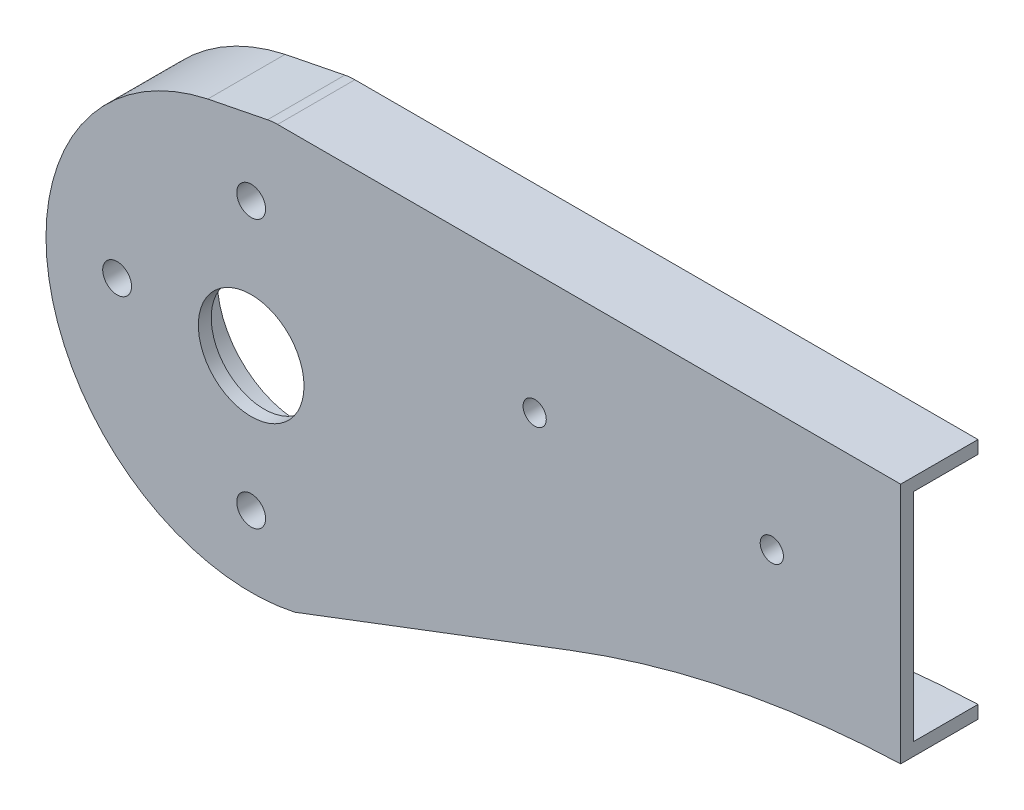
from build123d import *

# Parameters (mm, degrees)
ESTRUSIONE_ESTRUSIONE1_DEPTH = 2.5
ESTRUSIONE_ESTRUSIONE2_DEPTH = 15
SCHIZZO2_R                   = 10.25
SCHIZZO2_R_2                 = 2.8
TAGLIO_ESTRUSIONE1_DEPTH     = 15
SCHIZZO3_R                   = 16.1
SCHIZZO3_R_2                 = 14.5
ESTRUSIONE_ESTRUSIONE3_DEPTH = 0.5
SCHIZZO3_3_R                 = 6.3
SCHIZZO3_3_R_2               = 2.25
ESTRUSIONE_ESTRUSIONE4_DEPTH = 3
SCHIZZO3_4_R                 = 5
SCHIZZO3_4_R_2               = 2.8
ESTRUSIONE_ESTRUSIONE5_DEPTH = 5.6
SCHIZZO3_5_R                 = 18.6
SCHIZZO3_5_R_2               = 16.1
ESTRUSIONE_ESTRUSIONE6_DEPTH = 7
SMUSSO1_SIZE                 = 1.5
FORO_PER_VITE_M4_1_D         = 4.5
FORO_PER_VITE_M4_1_DEPTH     = 50
FORO_PER_VITE_M4_1_TIP       = 1.351936393


with BuildPart() as part:
    # Schizzo1 → Estrusione-Estrusione1 (new body)
    with BuildSketch(Plane.XY):
        with BuildLine():
            Line((126, -3.098457484), (126, 38.9))
            Line((126, 38.9), (5.368261151, 38.9))
            ThreePointArc((5.368261151, 38.9), (4.386962529, 38.851736181), (3.415136151, 38.707410603))
            Line((3.415136151, 38.707410603), (-7.887409345, 36.456532663))
            ThreePointArc((-7.887409345, 36.456532663), (-36.456532663, -7.887409345), (7.887409345, -36.456532663))
            Line((7.887409345, -36.456532663), (61.100428827, -16.194450472))
            ThreePointArc((61.100428827, -16.194450472), (93.011370492, -6.976115085), (126, -3.098457484))
        make_face()
        with BuildLine():
            Line((126, 41.4), (5.123487201, 41.4))
            ThreePointArc((5.123487201, 41.4), (4.142188579, 41.351736181), (3.170362201, 41.207410603))
            Line((3.170362201, 41.207410603), (-7.128704932, 39.156373249))
            Line((-7.128704932, 39.156373249), (-8.416056083, 38.9))
            ThreePointArc((-8.416056083, 38.9), (-38.9, -8.416056083), (8.416056083, -38.9))
            Line((8.416056083, -38.9), (61.98889523, -18.531249019))
            ThreePointArc((61.98889523, -18.531249019), (93.463092461, -9.435358059), (126, -5.6))
            Line((126, -5.6), (126, -3.098457484))
            ThreePointArc((126, -3.098457484), (93.011370492, -6.976115085), (61.100428827, -16.194450472))
            Line((61.100428827, -16.194450472), (7.887409345, -36.456532663))
            ThreePointArc((7.887409345, -36.456532663), (-36.456532663, -7.887409345), (-7.887409345, 36.456532663))
            Line((-7.887409345, 36.456532663), (3.415136151, 38.707410603))
            ThreePointArc((3.415136151, 38.707410603), (4.386962529, 38.851736181), (5.368261151, 38.9))
            Line((5.368261151, 38.9), (126, 38.9))
            Line((126, 38.9), (126, 41.4))
        make_face()
    extrude(amount=-ESTRUSIONE_ESTRUSIONE1_DEPTH)

    # Schizzo1<3> → Estrusione-Estrusione2 (add)
    with BuildSketch(Plane.XY):
        with BuildLine():
            Line((126, 41.4), (5.123487201, 41.4))
            ThreePointArc((5.123487201, 41.4), (4.142188579, 41.351736181), (3.170362201, 41.207410603))
            Line((3.170362201, 41.207410603), (-7.128704932, 39.156373249))
            Line((-7.128704932, 39.156373249), (-8.416056083, 38.9))
            ThreePointArc((-8.416056083, 38.9), (-38.9, -8.416056083), (8.416056083, -38.9))
            Line((8.416056083, -38.9), (61.98889523, -18.531249019))
            ThreePointArc((61.98889523, -18.531249019), (93.463092461, -9.435358059), (126, -5.6))
            Line((126, -5.6), (126, -3.098457484))
            ThreePointArc((126, -3.098457484), (93.011370492, -6.976115085), (61.100428827, -16.194450472))
            Line((61.100428827, -16.194450472), (7.887409345, -36.456532663))
            ThreePointArc((7.887409345, -36.456532663), (-36.456532663, -7.887409345), (-7.887409345, 36.456532663))
            Line((-7.887409345, 36.456532663), (3.415136151, 38.707410603))
            ThreePointArc((3.415136151, 38.707410603), (4.386962529, 38.851736181), (5.368261151, 38.9))
            Line((5.368261151, 38.9), (126, 38.9))
            Line((126, 38.9), (126, 41.4))
        make_face()
    extrude(amount=-ESTRUSIONE_ESTRUSIONE2_DEPTH)

    # Schizzo2 → Taglio-Estrusione1 (cut)
    with BuildSketch(Plane.XY):
        Circle(SCHIZZO2_R)
        with Locations((0, -26)):
            Circle(SCHIZZO2_R_2)
        with Locations((0, 26)):
            Circle(SCHIZZO2_R_2)
        with Locations((-26, 0)):
            Circle(SCHIZZO2_R_2)
    extrude(amount=-TAGLIO_ESTRUSIONE1_DEPTH, mode=Mode.SUBTRACT)

    # Schizzo3 → Estrusione-Estrusione3 (add)
    with BuildSketch(Plane(origin=(0, 0, -2.5), x_dir=(-1, 0, 0), z_dir=(0, 0, -1))):
        with Locations(Location((0, 0, 0), (0, 0, 180))):
            Circle(SCHIZZO3_R)
        Circle(SCHIZZO3_R_2, mode=Mode.SUBTRACT)
    extrude(amount=ESTRUSIONE_ESTRUSIONE3_DEPTH)

    # Schizzo3<3> → Estrusione-Estrusione4 (add)
    # profile 1 of 2: a face of its own
    with BuildSketch(Plane(origin=(0, 0, -2.5), x_dir=(-1, 0, 0), z_dir=(0, 0, -1))):
        with Locations(Location((-101, 17.9, 0), (0, 0, 180))):
            Circle(SCHIZZO3_3_R)
        with Locations((-101, 17.9)):
            Circle(SCHIZZO3_3_R_2, mode=Mode.SUBTRACT)
    # profile 2 of 2: a face of its own
    with BuildSketch(Plane(origin=(0, 0, -2.5), x_dir=(-1, 0, 0), z_dir=(0, 0, -1))):
        with Locations(Location((-55, 17.9, 0), (0, 0, 180))):
            Circle(SCHIZZO3_3_R)
        with Locations((-55, 17.9)):
            Circle(SCHIZZO3_3_R_2, mode=Mode.SUBTRACT)
    extrude(amount=ESTRUSIONE_ESTRUSIONE4_DEPTH)

    # Schizzo3<4> → Estrusione-Estrusione5 (add)
    # profile 1 of 4: a face of its own
    with BuildSketch(Plane(origin=(0, 0, -2.5), x_dir=(-1, 0, 0), z_dir=(0, 0, -1))):
        with Locations(Location((0, 26, 0), (0, 0, 180))):
            Circle(SCHIZZO3_4_R)
        with Locations(Location((0, 26, 0), (0, 0, 180))):
            Circle(SCHIZZO3_4_R_2, mode=Mode.SUBTRACT)
    # profile 2 of 4: a face of its own
    with BuildSketch(Plane(origin=(0, 0, -2.5), x_dir=(-1, 0, 0), z_dir=(0, 0, -1))):
        with Locations(Location((26, 0, 0), (0, 0, 180))):
            Circle(SCHIZZO3_4_R)
        with Locations(Location((26, 0, 0), (0, 0, 180))):
            Circle(SCHIZZO3_4_R_2, mode=Mode.SUBTRACT)
    # profile 3 of 4: a face of its own
    with BuildSketch(Plane(origin=(0, 0, -2.5), x_dir=(-1, 0, 0), z_dir=(0, 0, -1))):
        with Locations(Location((-26, 0, 0), (0, 0, 180))):
            Circle(SCHIZZO3_4_R)
        with Locations((-26, 0)):
            Circle(SCHIZZO3_4_R_2, mode=Mode.SUBTRACT)
    # profile 4 of 4: a face of its own
    with BuildSketch(Plane(origin=(0, 0, -2.5), x_dir=(-1, 0, 0), z_dir=(0, 0, -1))):
        with Locations(Location((0, -26, 0), (0, 0, 180))):
            Circle(SCHIZZO3_4_R)
        with Locations(Location((0, -26, 0), (0, 0, 180))):
            Circle(SCHIZZO3_4_R_2, mode=Mode.SUBTRACT)
    extrude(amount=ESTRUSIONE_ESTRUSIONE5_DEPTH)

    # Schizzo3<5> → Estrusione-Estrusione6 (add)
    with BuildSketch(Plane(origin=(0, 0, -2.5), x_dir=(-1, 0, 0), z_dir=(0, 0, -1))):
        with Locations(Location((0, 0, 0), (0, 0, 180))):
            Circle(SCHIZZO3_5_R)
        Circle(SCHIZZO3_5_R_2, mode=Mode.SUBTRACT)
    extrude(amount=ESTRUSIONE_ESTRUSIONE6_DEPTH)

    # Smusso1
    # the kernel refuses this chamfer: 1.5 mm, written as the material it adds along each edge
    with BuildSketch(Plane(origin=(0, 26, -2.5), x_dir=(1, 0, 0), z_dir=(0, 1, 0))) as smusso1_piece_1:
        Polygon((5, SMUSSO1_SIZE), (5 + SMUSSO1_SIZE, 0), (5, 0), align=None)
    revolve(axis=Axis((0, 26, -2.5), (0, 0, -1)))
    with BuildSketch(Plane(origin=(-26, 0, -2.5), x_dir=(1, 0, 0), z_dir=(0, 1, 0))) as smusso1_piece_2:
        Polygon((5, SMUSSO1_SIZE), (5 + SMUSSO1_SIZE, 0), (5, 0), align=None)
    revolve(axis=Axis((-26, 0, -2.5), (0, 0, -1)))
    with BuildSketch(Plane(origin=(26, 0, -2.5), x_dir=(1, 0, 0), z_dir=(0, 1, 0))) as smusso1_piece_3:
        Polygon((5 + SMUSSO1_SIZE, 0), (5, SMUSSO1_SIZE), (5, 0), align=None)
    revolve(axis=Axis((26, 0, -2.5), (0, 0, -1)))
    with BuildSketch(Plane(origin=(0, -26, -2.5), x_dir=(1, 0, 0), z_dir=(0, 1, 0))) as smusso1_piece_4:
        Polygon((5, SMUSSO1_SIZE), (5 + SMUSSO1_SIZE, 0), (5, 0), align=None)
    revolve(axis=Axis((0, -26, -2.5), (0, 0, -1)))
    with BuildSketch(Plane(origin=(0, 0, -2.5), x_dir=(1, 0, 0), z_dir=(0, 1, 0))) as smusso1_piece_5:
        Polygon((18.6, SMUSSO1_SIZE), (18.6 + SMUSSO1_SIZE, 0), (18.6, 0), align=None)
    revolve(axis=Axis((0, 0, -2.5), (0, 0, -1)))
    # the kernel refuses this chamfer: 1.5 mm, written as the material it takes off along each edge
    with BuildSketch(Plane(origin=(55, 17.9, -5.5), x_dir=(1, 0, 0), z_dir=(0, 1, 0))) as smusso1_2_piece_1:
        Polygon((6.3, -SMUSSO1_SIZE), (6.3 - SMUSSO1_SIZE, 0), (6.3, 0), align=None)
    revolve(axis=Axis((55, 17.9, -5.5), (0, 0, -1)), mode=Mode.SUBTRACT)
    with BuildSketch(Plane(origin=(101, 17.9, -5.5), x_dir=(1, 0, 0), z_dir=(0, 1, 0))) as smusso1_2_piece_2:
        Polygon((6.3, -SMUSSO1_SIZE), (6.3 - SMUSSO1_SIZE, 0), (6.3, 0), align=None)
    revolve(axis=Axis((101, 17.9, -5.5), (0, 0, -1)), mode=Mode.SUBTRACT)

    # Foro per Vite M4-1
    with Locations(Plane.XY):
        with Locations((55, 17.9), (101, 17.9)):
            Hole(FORO_PER_VITE_M4_1_D / 2, depth=FORO_PER_VITE_M4_1_DEPTH)
            with Locations((0, 0, -(FORO_PER_VITE_M4_1_DEPTH + FORO_PER_VITE_M4_1_TIP / 2))):  # 118° drill point
                Cone(0, FORO_PER_VITE_M4_1_D / 2, FORO_PER_VITE_M4_1_TIP, mode=Mode.SUBTRACT)


solid = part.part
